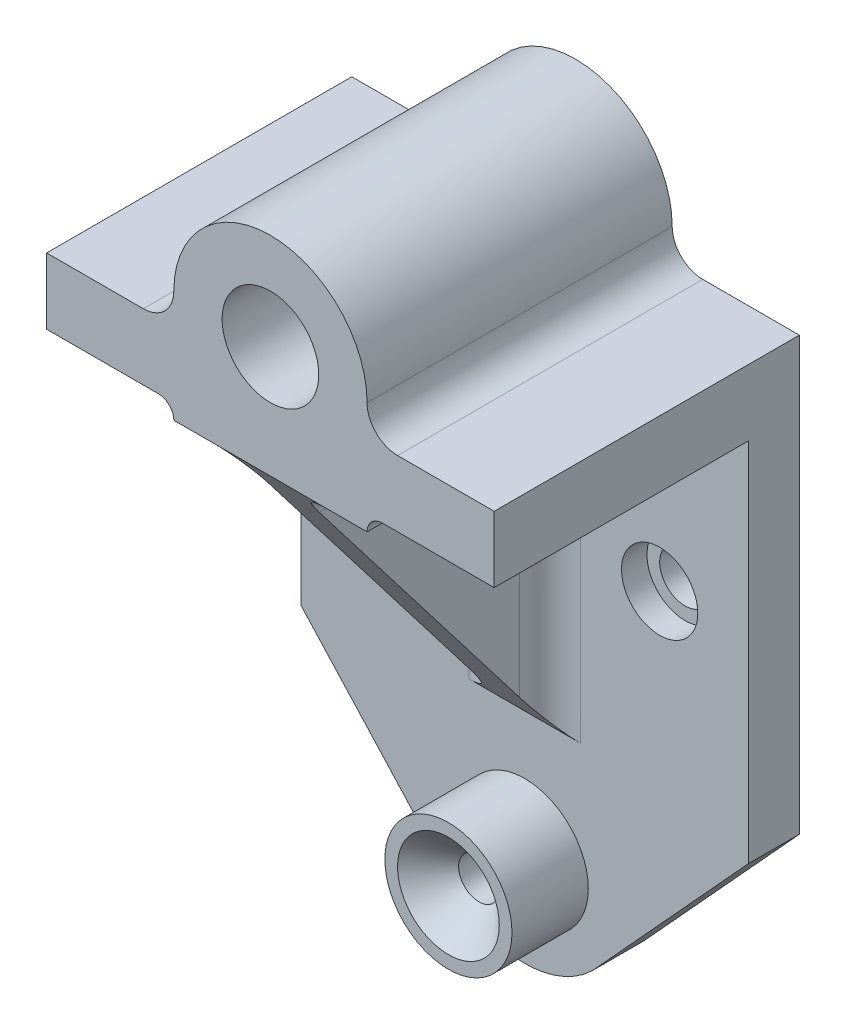
from build123d import *

# Parameters (mm, degrees)
SKETCH1_R           = 9.5
BOSS_EXTRUDE1_DEPTH = 60
BOSS_EXTRUDE2_DEPTH = 10
FILLET1_R           = 6
FILLET2_R           = 6
FILLET3_R           = 3
BOSS_EXTRUDE4_DEPTH = 5
FILLET4_R           = 6
FILLET5_R           = 6
SKETCH6_R           = 12.5
BOSS_EXTRUDE5_DEPTH = 20
HOLE2_D             = 8
HOLE2_DEPTH         = 39.547439867
HOLE2_CSINK_D       = 20
HOLE2_CSINK_ANGLE   = 90
CUT_EXTRUDE1_START  = -40
SKETCH13_R          = 4
CUT_EXTRUDE1_DEPTH  = 40
HOLE4_D             = 10
HOLE4_CBORE_D       = 15
HOLE4_CBORE_DEPTH   = 5


# Some blends are built 0.0001 mm under size
with BuildPart() as part:
    # Sketch1 → Boss-Extrude1 (new body)
    with BuildSketch(Plane.XY):
        with BuildLine():
            Line((0, 0), (38, 0))
            Line((38, 0), (38, 3))
            Line((38, 3), (63, 3))
            Line((63, 3), (63, 16))
            Line((63, 16), (38, 16))
            Line((38, 16), (38, 22))
            ThreePointArc((38, 22), (19, 41), (0, 22))
            Line((0, 22), (0, 16))
            Line((0, 16), (-25, 16))
            Line((-25, 16), (-25, 3))
            Line((-25, 3), (0, 3))
            Line((0, 3), (0, 0))
        make_face()
        with Locations((19, 22)):
            Circle(SKETCH1_R, mode=Mode.SUBTRACT)
    extrude(amount=BOSS_EXTRUDE1_DEPTH)

    # Sketch2 → Boss-Extrude2 (add)
    with BuildSketch(Plane.XY):
        with BuildLine():
            Line((63, -69), (63, 3))
            Line((63, 3), (38, 3))
            Line((38, 3), (38, 0))
            Line((38, 0), (19, 0))
            Line((19, 0), (0, 0))
            Line((0, 0), (0, 3))
            Line((0, 3), (-25, 3))
            Line((-25, 3), (-25, -69))
            Line((-25, -69), (4.520418495, -101.302102237))
            ThreePointArc((4.520418495, -101.302102237), (18.194672039, -107.98292514), (32.385626244, -102.484250445))
            Line((32.385626244, -102.484250445), (33.626524101, -101.127027365))
            Line((33.626524101, -101.127027365), (63, -69))
        make_face()
        with BuildLine():
            ThreePointArc((19, -101.5), (6.5, -89), (19, -76.5))
            ThreePointArc((19, -76.5), (27.838834765, -80.161165235), (31.5, -89))
            ThreePointArc((31.5, -89), (27.838834765, -97.838834765), (19, -101.5))
        make_face(mode=Mode.SUBTRACT)
    extrude(amount=BOSS_EXTRUDE2_DEPTH)

    # Fillet1
    fillet1_edges = [part.edges().sort_by_distance(p)[0] for p in [
        (0, 16, 30),
    ]]
    fillet(fillet1_edges, radius=FILLET1_R - 0.0001)  # a hair under: the kernel refuses the full size

    # Fillet2
    fillet2_edges = [part.edges().sort_by_distance(p)[0] for p in [
        (38, 16, 30),
    ]]
    fillet(fillet2_edges, radius=FILLET2_R - 0.0001)  # a hair under: the kernel refuses the full size

    # Fillet3
    fillet3_edges = [part.edges().sort_by_distance(p)[0] for p in [
        (0, 3, 35),
        (38, 3, 35),
    ]]
    fillet(fillet3_edges, radius=FILLET3_R - 0.0001)  # a hair under: the kernel refuses the full size

    # Sketch4 → Boss-Extrude4 (add, symmetric)
    with BuildSketch(Plane(origin=(19, 0, 0), x_dir=(0, 0, -1), z_dir=(1, 0, 0))):
        Polygon((-60, 0), (-10, -65), (-10, 0), align=None)
    extrude(amount=BOSS_EXTRUDE4_DEPTH, both=True)

    # Fillet4
    # the kernel refuses this fillet: 6 mm, written as the material it adds along each edge
    with BuildSketch(Plane(origin=(14, 0, -5), x_dir=(-1, 0, 0), z_dir=(0, 0, 1))) as fillet4_piece_1_section:
        with BuildLine():
            CenterArc((FILLET4_R, FILLET4_R), FILLET4_R, 180, 90)
            Line((0, FILLET4_R), (0, 0))
            Line((0, 0), (FILLET4_R, 0))
        make_face()
    fillet4_piece_1 = extrude(amount=80, mode=Mode.PRIVATE)
    fillet4_piece_1 = split(fillet4_piece_1, bisect_by=Plane(origin=(12.648095827, -13.156695973, 49.879464636), z_dir=(0, 0.6097107608496924, -0.7926239891046001)), keep=Keep.TOP, mode=Mode.PRIVATE)
    fillet4_piece_1 = split(fillet4_piece_1, bisect_by=Plane(origin=(12.648095827, -1.320325191, 0), z_dir=(0, 0, 1)), keep=Keep.TOP, mode=Mode.PRIVATE)
    add(fillet4_piece_1)
    with BuildSketch(Plane(origin=(24, 0, -5), x_dir=(1, 0, 0), z_dir=(0, 0, 1))) as fillet4_piece_2_section:
        with BuildLine():
            CenterArc((FILLET4_R, -FILLET4_R), FILLET4_R, 90, 90)
            Line((0, -FILLET4_R), (0, 0))
            Line((0, 0), (FILLET4_R, 0))
        make_face()
    fillet4_piece_2 = extrude(amount=80, mode=Mode.PRIVATE)
    fillet4_piece_2 = split(fillet4_piece_2, bisect_by=Plane(origin=(25.351904173, -13.156695973, 49.879464636), z_dir=(0, 0.6097107608496924, -0.7926239891046001)), keep=Keep.TOP, mode=Mode.PRIVATE)
    fillet4_piece_2 = split(fillet4_piece_2, bisect_by=Plane(origin=(25.351904173, -1.320325191, 0), z_dir=(0, 0, 1)), keep=Keep.TOP, mode=Mode.PRIVATE)
    add(fillet4_piece_2)

    # Fillet5
    # the kernel refuses this fillet: 6 mm, written as the material it adds along each edge
    with BuildSketch(Plane(origin=(24, -80, 10), x_dir=(1, 0, 0), z_dir=(0, 1, 0))) as fillet5_piece_1_section:
        with BuildLine():
            CenterArc((FILLET5_R, -FILLET5_R), FILLET5_R, 90, 90)
            Line((0, -FILLET5_R), (0, 0))
            Line((0, 0), (FILLET5_R, 0))
        make_face()
    fillet5_piece_1 = extrude(amount=89, mode=Mode.PRIVATE)
    fillet5_piece_1 = split(fillet5_piece_1, bisect_by=Plane(origin=(25.330544352, -46.320917546, 24.368524964), z_dir=(0, 0.6097107608496924, -0.7926239891046002)), keep=Keep.TOP, mode=Mode.PRIVATE)
    add(fillet5_piece_1)
    with BuildSketch(Plane(origin=(14, -80, 10), x_dir=(-1, 0, 0), z_dir=(0, 1, 0))) as fillet5_piece_2_section:
        with BuildLine():
            CenterArc((FILLET5_R, FILLET5_R), FILLET5_R, 180, 90)
            Line((0, FILLET5_R), (0, 0))
            Line((0, 0), (FILLET5_R, 0))
        make_face()
    fillet5_piece_2 = extrude(amount=89, mode=Mode.PRIVATE)
    fillet5_piece_2 = split(fillet5_piece_2, bisect_by=Plane(origin=(12.669455648, -46.320917546, 24.368524964), z_dir=(0, 0.6097107608496924, -0.7926239891046002)), keep=Keep.TOP, mode=Mode.PRIVATE)
    add(fillet5_piece_2)

    # Sketch6 → Boss-Extrude5 (add, symmetric)
    with BuildSketch(Plane.XY.offset(5)):
        with Locations((19, -89)):
            Circle(SKETCH6_R)
    extrude(amount=BOSS_EXTRUDE5_DEPTH, both=True)

    # Hole2
    with Locations(Plane.XY.offset(25)):
        with Locations((19, -89)):
            CounterSinkHole(HOLE2_D / 2, HOLE2_CSINK_D / 2, depth=HOLE2_DEPTH, counter_sink_angle=HOLE2_CSINK_ANGLE)

    # Sketch13 → Cut-Extrude1 (cut)
    with BuildSketch(Plane.XY.offset(-14.547439867).offset(CUT_EXTRUDE1_START)):
        with Locations((19, -89)):
            Circle(SKETCH13_R)
    extrude(amount=CUT_EXTRUDE1_DEPTH, mode=Mode.SUBTRACT)

    # Hole4 (through all)
    with Locations(Plane(origin=(-7.536351987, -31.351857419, 10), x_dir=(1, 0, 0), z_dir=(0, 0, 1))):
        with Locations((0, 0)):
            hole4 = CounterBoreHole(HOLE4_D / 2, HOLE4_CBORE_D / 2, HOLE4_CBORE_DEPTH)

    # Mirror2: Hole4 across plane
    add(hole4.mirror(Plane(origin=(19, 0, 0), x_dir=(0, 0, 1), z_dir=(1, 0, 0))), mode=Mode.SUBTRACT)


solid = part.part
